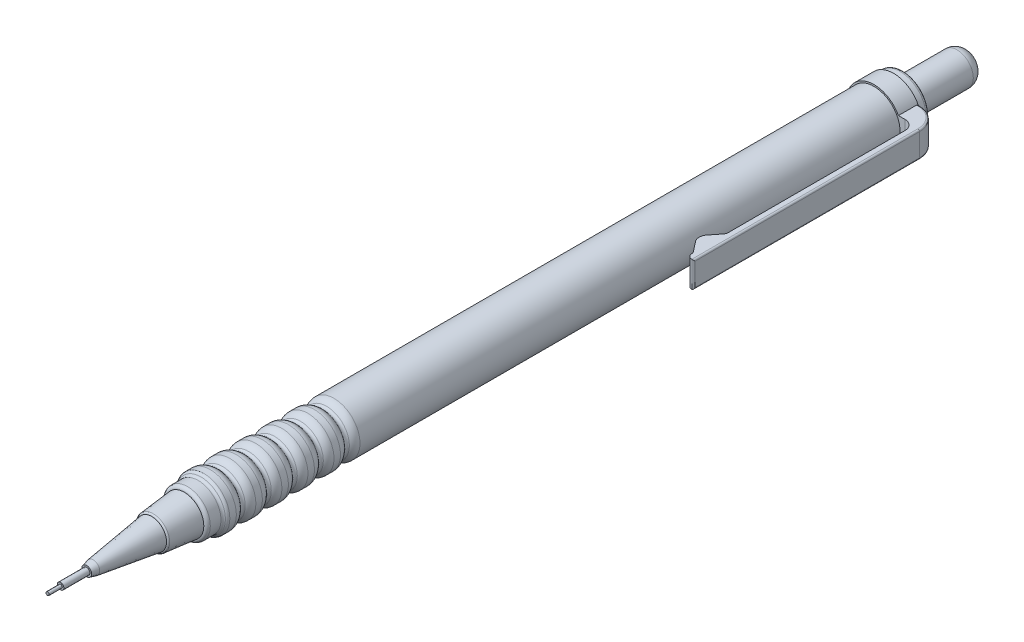
from build123d import *

# Parameters (mm, degrees)
SKETCH1_R            = 4
BOSS_EXTRUDE1_DEPTH  = 89
FILLET2_R            = 0.5
FILLET3_R            = 1.5
SKETCH2_R            = 4
BOSS_EXTRUDE2_DEPTH  = 4
FILLET4_R            = 1.5
FILLET5_R            = 1.5
SKETCH3_R            = 4
BOSS_EXTRUDE3_DEPTH  = 4
FILLET6_R            = 1.5
SKETCH4_R            = 4
BOSS_EXTRUDE4_DEPTH  = 4
FILLET7_R            = 1.5
SKETCH5_R            = 4
BOSS_EXTRUDE5_DEPTH  = 4
FILLET8_R            = 1.5
FILLET9_R            = 1.5
FILLET10_R           = 1.5
FILLET11_R           = 1.5
SKETCH6_R            = 4
BOSS_EXTRUDE6_DEPTH  = 3
FILLET12_R           = 1.5
FILLET13_R           = 0.5
FILLET14_R           = 0.5
FILLET15_R           = 0.5
SKETCH7_R            = 3.5
BOSS_EXTRUDE7_DEPTH  = 2.5
FILLET16_R           = 0.5
FILLET17_R           = 0.5
SKETCH8_R            = 3
BOSS_EXTRUDE8_DEPTH  = 5
CHAMFER1_SIZE2       = 0.5
CHAMFER1_SIZE        = 5
FILLET18_R           = 0.25
SKETCH10_R           = 2.273753109
BOSS_EXTRUDE9_DEPTH  = 9
CHAMFER2_SIZE2       = 1.27
CHAMFER2_SIZE        = 9
SKETCH13_R           = 1.003753109
BOSS_EXTRUDE10_DEPTH = 1
CHAMFER3_SIZE2       = 0.25
CHAMFER3_SIZE        = 1
SKETCH14_R           = 0.5
BOSS_EXTRUDE11_DEPTH = 4
SKETCH15_R           = 0.25
BOSS_EXTRUDE13_DEPTH = 2
SKETCH16_R           = 4.25
BOSS_EXTRUDE14_DEPTH = 3
SKETCH17_R           = 2.5
BOSS_EXTRUDE15_DEPTH = 10
SKETCH18_W           = 3.5
SKETCH18_H           = 4
BOSS_EXTRUDE16_DEPTH = 3
SKETCH19_W           = 1
SKETCH19_H           = 4
BOSS_EXTRUDE17_DEPTH = 38
FILLET20_R           = 3.25
FILLET21_R           = 1.75
FILLET22_R           = 1.5
FILLET23_R           = 0.25
BOSS_EXTRUDE20_DEPTH = 4
FILLET24_R           = 0.75
FILLET25_R           = 0.75
FILLET26_R           = 0.75
FILLET28_R           = 1.25
FILLET29_R           = 1.25


# Some blends are built 0.0001 mm under size
with BuildPart() as part:
    # Sketch1 → Boss-Extrude1 (new body)
    with BuildSketch(Plane.XY):
        Circle(SKETCH1_R)
    extrude(amount=BOSS_EXTRUDE1_DEPTH)

    # Fillet2
    fillet2_edges = [part.edges().sort_by_distance(p)[0] for p in [
        (-4, 0, 0),
    ]]
    fillet(fillet2_edges, radius=FILLET2_R)

    # Fillet3
    fillet3_edges = [part.edges().sort_by_distance(p)[0] for p in [
        (-4, 0, 89),
    ]]
    fillet(fillet3_edges, radius=FILLET3_R)

    # Sketch2 → Boss-Extrude2 (add)
    with BuildSketch(Plane.XY.offset(89)):
        Circle(SKETCH2_R)
    extrude(amount=BOSS_EXTRUDE2_DEPTH)

    # Fillet4
    fillet4_edges = [part.edges().sort_by_distance(p)[0] for p in [
        (-4, 0, 89),
    ]]
    fillet(fillet4_edges, radius=FILLET4_R - 0.0001)  # a hair under: the kernel refuses the full size

    # Fillet5
    fillet5_edges = [part.edges().sort_by_distance(p)[0] for p in [
        (-4, 0, 93),
    ]]
    fillet(fillet5_edges, radius=FILLET5_R)

    # Sketch3 → Boss-Extrude3 (add)
    with BuildSketch(Plane.XY.offset(93)):
        Circle(SKETCH3_R)
    extrude(amount=BOSS_EXTRUDE3_DEPTH)

    # Fillet6
    fillet6_edges = [part.edges().sort_by_distance(p)[0] for p in [
        (-4, 0, 97),
    ]]
    fillet(fillet6_edges, radius=FILLET6_R)

    # Sketch4 → Boss-Extrude4 (add)
    with BuildSketch(Plane.XY.offset(97)):
        Circle(SKETCH4_R)
    extrude(amount=BOSS_EXTRUDE4_DEPTH)

    # Fillet7
    fillet7_edges = [part.edges().sort_by_distance(p)[0] for p in [
        (-4, 0, 101),
    ]]
    fillet(fillet7_edges, radius=FILLET7_R)

    # Sketch5 → Boss-Extrude5 (add)
    with BuildSketch(Plane.XY.offset(101)):
        Circle(SKETCH5_R)
    extrude(amount=BOSS_EXTRUDE5_DEPTH)

    # Fillet8
    fillet8_edges = [part.edges().sort_by_distance(p)[0] for p in [
        (-4, 0, 93),
    ]]
    fillet(fillet8_edges, radius=FILLET8_R - 0.0001)  # a hair under: the kernel refuses the full size

    # Fillet9
    fillet9_edges = [part.edges().sort_by_distance(p)[0] for p in [
        (-4, 0, 97),
    ]]
    fillet(fillet9_edges, radius=FILLET9_R - 0.0001)  # a hair under: the kernel refuses the full size

    # Fillet10
    fillet10_edges = [part.edges().sort_by_distance(p)[0] for p in [
        (-4, 0, 101),
    ]]
    fillet(fillet10_edges, radius=FILLET10_R - 0.0001)  # a hair under: the kernel refuses the full size

    # Fillet11
    fillet11_edges = [part.edges().sort_by_distance(p)[0] for p in [
        (-4, 0, 105),
    ]]
    fillet(fillet11_edges, radius=FILLET11_R)

    # Sketch6 → Boss-Extrude6 (add)
    with BuildSketch(Plane.XY.offset(105)):
        Circle(SKETCH6_R)
    extrude(amount=BOSS_EXTRUDE6_DEPTH)

    # Fillet12
    fillet12_edges = [part.edges().sort_by_distance(p)[0] for p in [
        (-4, 0, 105),
    ]]
    fillet(fillet12_edges, radius=FILLET12_R - 0.0001)  # a hair under: the kernel refuses the full size

    # Fillet13
    # the kernel refuses this fillet: 0.5 mm, written as the material it adds along each edge
    with BuildSketch(Plane(origin=(0, 0, 105), x_dir=(1, 0, 0), z_dir=(0, -1, 0))) as fillet13_piece_1:
        with BuildLine():
            CenterArc((3.822906757, -2.7429e-05), FILLET13_R, 131.40951688, 97.179673012)
            Line((3.492180068, -0.375020572), (3.459107399, -0.412519886))
            ThreePointArc((3.459107399, -0.412519886), (3.012666478, -0.143654512), (2.5, -0.05))
            Line((2.5, -0.05), (2.5, 0.05))
            ThreePointArc((2.5, 0.05), (2.5001, 0.05), (3.459116709, 0.412473239))
            Line((3.459116709, 0.412473239), (3.492188532, 0.374973178))
        make_face()
    revolve(axis=Axis((0, 0, 105), (0, 0, 1)))

    # Fillet14
    # the kernel refuses this fillet: 0.5 mm, written as the material it adds along each edge
    with BuildSketch(Plane(origin=(0, 0, 93), x_dir=(1, 0, 0), z_dir=(0, -1, 0))) as fillet14_piece_1:
        with BuildLine():
            CenterArc((3.822906757, -2.7429e-05), FILLET14_R, 131.40951688, 97.179673012)
            Line((3.492180068, -0.375020572), (3.459107399, -0.412519886))
            ThreePointArc((3.459107399, -0.412519886), (3.012666478, -0.143654512), (2.5, -0.05))
            Line((2.5, -0.05), (2.5, 0.05))
            ThreePointArc((2.5, 0.05), (2.5001, 0.05), (3.459116709, 0.412473239))
            Line((3.459116709, 0.412473239), (3.492188532, 0.374973178))
        make_face()
    revolve(axis=Axis((0, 0, 93), (0, 0, 1)))
    with BuildSketch(Plane(origin=(0, 0, 97), x_dir=(1, 0, 0), z_dir=(0, -1, 0))) as fillet14_piece_2:
        with BuildLine():
            CenterArc((3.822906757, -2.7429e-05), FILLET14_R, 131.40951688, 97.179673012)
            Line((3.492180068, -0.375020572), (3.459107399, -0.412519886))
            ThreePointArc((3.459107399, -0.412519886), (3.012666478, -0.143654512), (2.5, -0.05))
            Line((2.5, -0.05), (2.5, 0.05))
            ThreePointArc((2.5, 0.05), (2.5001, 0.05), (3.459116709, 0.412473239))
            Line((3.459116709, 0.412473239), (3.492188532, 0.374973178))
        make_face()
    revolve(axis=Axis((0, 0, 97), (0, 0, 1)))
    with BuildSketch(Plane(origin=(0, 0, 101), x_dir=(1, 0, 0), z_dir=(0, -1, 0))) as fillet14_piece_3:
        with BuildLine():
            CenterArc((3.822906757, -2.7429e-05), FILLET14_R, 131.40951688, 97.179673012)
            Line((3.492180068, -0.375020572), (3.459107399, -0.412519886))
            ThreePointArc((3.459107399, -0.412519886), (3.012666478, -0.143654512), (2.5, -0.05))
            Line((2.5, -0.05), (2.5, 0.05))
            ThreePointArc((2.5, 0.05), (2.5001, 0.05), (3.459116709, 0.412473239))
            Line((3.459116709, 0.412473239), (3.492188532, 0.374973178))
        make_face()
    revolve(axis=Axis((0, 0, 101), (0, 0, 1)))
    with BuildSketch(Plane(origin=(0, 0, 89), x_dir=(1, 0, 0), z_dir=(0, -1, 0))) as fillet14_piece_4:
        with BuildLine():
            CenterArc((3.822906757, -2.7429e-05), FILLET14_R, 131.40951688, 97.179673012)
            Line((3.492180068, -0.375020572), (3.459107399, -0.412519886))
            ThreePointArc((3.459107399, -0.412519886), (3.012666478, -0.143654512), (2.5, -0.05))
            Line((2.5, -0.05), (2.5, 0.05))
            ThreePointArc((2.5, 0.05), (2.5001, 0.05), (3.459116709, 0.412473239))
            Line((3.459116709, 0.412473239), (3.492188532, 0.374973178))
        make_face()
    revolve(axis=Axis((0, 0, 89), (0, 0, 1)))

    # Fillet15
    fillet15_edges = [part.edges().sort_by_distance(p)[0] for p in [
        (-4, 0, 108),
    ]]
    fillet(fillet15_edges, radius=FILLET15_R)

    # Sketch7 → Boss-Extrude7 (add)
    with BuildSketch(Plane.XY.offset(108)):
        Circle(SKETCH7_R)
    extrude(amount=BOSS_EXTRUDE7_DEPTH)

    # Fillet16
    fillet16_edges = [part.edges().sort_by_distance(p)[0] for p in [
        (-3.5, 0, 108),
    ]]
    fillet(fillet16_edges, radius=FILLET16_R)

    # Fillet17
    fillet17_edges = [part.edges().sort_by_distance(p)[0] for p in [
        (-3.5, 0, 110.5),
    ]]
    fillet(fillet17_edges, radius=FILLET17_R)

    # Sketch8 → Boss-Extrude8 (add)
    with BuildSketch(Plane.XY.offset(110.5)):
        Circle(SKETCH8_R)
    extrude(amount=BOSS_EXTRUDE8_DEPTH)

    # Chamfer1
    chamfer1_edges = [part.edges().sort_by_distance(p)[0] for p in [
        (-3, 0, 115.5),
    ]]
    chamfer1_side = [part.faces().sort_by_distance(p)[0] for p in [
        (-3, 0, 115.49),
    ]]
    chamfer(chamfer1_edges, length=CHAMFER1_SIZE - 0.0001, length2=CHAMFER1_SIZE2 - 0.0001, reference=chamfer1_side[0])  # a hair under: the kernel refuses the full size

    # Fillet18
    fillet18_edges = [part.edges().sort_by_distance(p)[0] for p in [
        (-2.5001, 0, 115.5),
    ]]
    fillet(fillet18_edges, radius=FILLET18_R)

    # Sketch10 → Boss-Extrude9 (add)
    with BuildSketch(Plane.XY.offset(115.5)):
        Circle(SKETCH10_R)
    extrude(amount=BOSS_EXTRUDE9_DEPTH)

    # Chamfer2
    chamfer2_edges = [part.edges().sort_by_distance(p)[0] for p in [
        (-2.273753109, 0, 124.5),
    ]]
    chamfer2_side = [part.faces().sort_by_distance(p)[0] for p in [
        (-2.273753109, 0, 124.4746),
    ]]
    chamfer(chamfer2_edges, length=CHAMFER2_SIZE - 0.0001, length2=CHAMFER2_SIZE2 - 0.0001, reference=chamfer2_side[0])  # a hair under: the kernel refuses the full size

    # Sketch13 → Boss-Extrude10 (add)
    with BuildSketch(Plane.XY.offset(124.5)):
        Circle(SKETCH13_R)
    extrude(amount=BOSS_EXTRUDE10_DEPTH)

    # Chamfer3
    chamfer3_edges = [part.edges().sort_by_distance(p)[0] for p in [
        (-1.003753109, 0, 125.5),
    ]]
    chamfer3_side = [part.faces().sort_by_distance(p)[0] for p in [
        (-1.003753109, 0, 125.495),
    ]]
    chamfer(chamfer3_edges, length=CHAMFER3_SIZE - 0.0001, length2=CHAMFER3_SIZE2 - 0.0001, reference=chamfer3_side[0])  # a hair under: the kernel refuses the full size

    # Sketch14 → Boss-Extrude11 (add)
    with BuildSketch(Plane.XY.offset(125.5)):
        Circle(SKETCH14_R)
    extrude(amount=BOSS_EXTRUDE11_DEPTH)

    # Sketch15 → Boss-Extrude13 (add)
    with BuildSketch(Plane.XY.offset(129.5)):
        Circle(SKETCH15_R)
    extrude(amount=BOSS_EXTRUDE13_DEPTH)

    # Sketch16 → Boss-Extrude14 (add)
    with BuildSketch(Plane(origin=(0, 0, 1.5), x_dir=(-1, 0, 0), z_dir=(0, 0, -1))):
        Circle(SKETCH16_R)
    extrude(amount=-BOSS_EXTRUDE14_DEPTH)

    # Sketch17 → Boss-Extrude15 (add)
    with BuildSketch(Plane(origin=(0, 0, 0), x_dir=(-1, 0, 0), z_dir=(0, 0, -1))):
        with Locations(Location((0, 0, 0), (0, 0, 180))):
            Circle(SKETCH17_R)
    extrude(amount=BOSS_EXTRUDE15_DEPTH)

    # Sketch18 → Boss-Extrude16 (add)
    with BuildSketch(Plane(origin=(0, 0, 1.5), x_dir=(-1, 0, 0), z_dir=(0, 0, -1))):
        with Locations((-5.5, 0)):
            Rectangle(SKETCH18_W, SKETCH18_H)
    extrude(amount=-BOSS_EXTRUDE16_DEPTH)

    # Sketch19 → Boss-Extrude17 (add)
    with BuildSketch(Plane(origin=(0, 0, 1.5), x_dir=(-1, 0, 0), z_dir=(0, 0, -1))):
        with Locations((-6.75, 0)):
            Rectangle(SKETCH19_W, SKETCH19_H)
    extrude(amount=-BOSS_EXTRUDE17_DEPTH)

    # Fillet20
    fillet20_edges = [part.edges().sort_by_distance(p)[0] for p in [
        (7.25, 0, 1.5),
    ]]
    fillet(fillet20_edges, radius=FILLET20_R - 0.0001)  # a hair under: the kernel refuses the full size

    # Fillet21
    fillet21_edges = [part.edges().sort_by_distance(p)[0] for p in [
        (-2.5, 0, -10),
    ]]
    fillet(fillet21_edges, radius=FILLET21_R)

    # Fillet22
    fillet22_edges = [part.edges().sort_by_distance(p)[0] for p in [
        (6.25, 0, 4.5),
    ]]
    fillet(fillet22_edges, radius=FILLET22_R)

    # Fillet23
    fillet23_edges = [part.edges().sort_by_distance(p)[0] for p in [
        (3.87505, 2, 1.5),
        (7.25, -2, 22.12495),
        (7.25, 2, 22.12495),
        (7.25, 0, 39.5),
        (3.87505, -2, 1.5),
        (6.298126328, -2, 2.451873672),
        (6.298126328, 2, 2.451873672),
    ]]
    fillet(fillet23_edges, radius=FILLET23_R)

    # Sketch20 → Boss-Extrude20 (add)
    with BuildSketch(Plane(origin=(0, 2, 0), x_dir=(1, 0, 0), z_dir=(0, 1, 0))):
        Polygon((6.25, -38.547580114), (6.25, -33.452419886), (4.637596576, -35.5), (4.637596576, -36.5), align=None)
    extrude(amount=-BOSS_EXTRUDE20_DEPTH)

    # Fillet24
    fillet24_edges = [part.edges().sort_by_distance(p)[0] for p in [
        (6.25, 0, 39.5),
    ]]
    fillet(fillet24_edges, radius=FILLET24_R - 0.0001)  # a hair under: the kernel refuses the full size

    # Fillet25
    fillet25_edges = [part.edges().sort_by_distance(p)[0] for p in [
        (6.25, 0, 38.547580114),
    ]]
    fillet(fillet25_edges, radius=FILLET25_R)

    # Fillet26
    fillet26_edges = [part.edges().sort_by_distance(p)[0] for p in [
        (6.25, 0, 33.452419886),
    ]]
    fillet(fillet26_edges, radius=FILLET26_R)

    # Fillet28
    fillet28_edges = [part.edges().sort_by_distance(p)[0] for p in [
        (4.637596576, 0, 36.5),
    ]]
    fillet(fillet28_edges, radius=FILLET28_R)

    # Fillet29
    fillet29_edges = [part.edges().sort_by_distance(p)[0] for p in [
        (4.637596576, 0, 35.5),
    ]]
    fillet(fillet29_edges, radius=FILLET29_R)


solid = part.part
